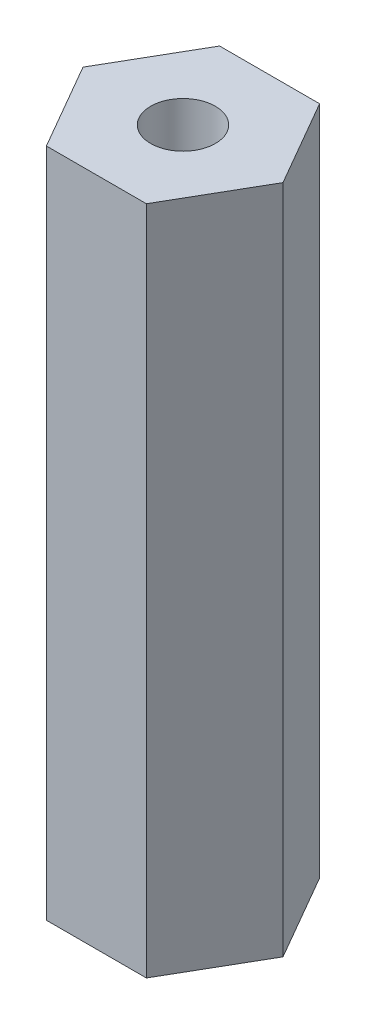
from build123d import *

# Parameters (mm, degrees)
BOSS_EXTRUDE1_DEPTH = 29.499999928
SKETCH2_R           = 1.4224
CUT_EXTRUDE1_DEPTH  = 31.068603156


with BuildPart() as part:
    # Sketch1 → Boss-Extrude1 (new body)
    with BuildSketch(Plane(origin=(0, 0, 0), x_dir=(1, 0, 0), z_dir=(0, 1, 0))):
        Polygon((4.399409051, 0), (2.199704526, 3.81), (-2.199704526, 3.81), (-4.399409051, 0), (-2.199704526, -3.81), (2.199704526, -3.81), align=None)
    extrude(amount=BOSS_EXTRUDE1_DEPTH)

    # Sketch2 → Cut-Extrude1 (cut, through all)
    with BuildSketch(Plane(origin=(0, 0, 0), x_dir=(-1, 0, 0), z_dir=(0, -1, 0))):
        Circle(SKETCH2_R)
    extrude(amount=-CUT_EXTRUDE1_DEPTH, mode=Mode.SUBTRACT)


solid = part.part
